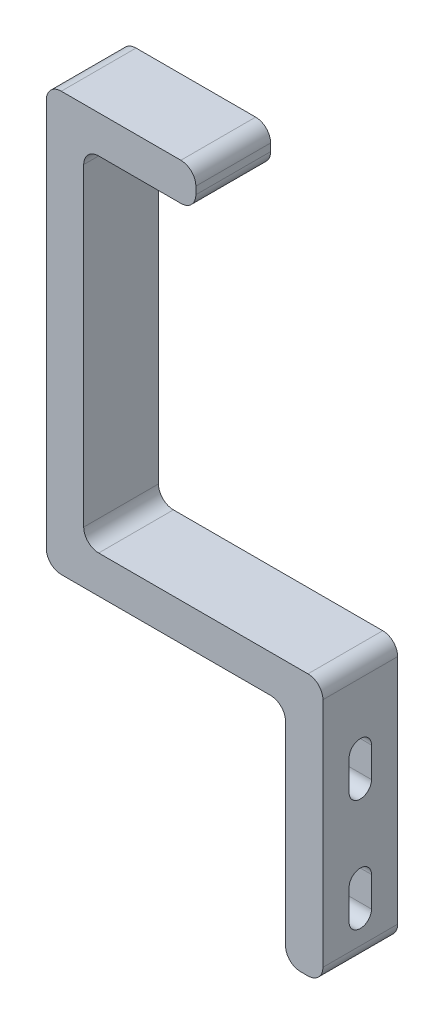
from build123d import *

# Parameters (mm, degrees)
BOSS_EXTRUDE1_DEPTH     = 10
CUT_EXTRUDE1_DEPTH      = 93.303846074
CUT_EXTRUDE1_DEPTH_BACK = 93.303846074
CHAMFER2_SIZE           = 2
CHAMFER2_SIZE2          = 1.154700538
FILLET1_R               = 2


with BuildPart() as part:
    # Sketch1 → Boss-Extrude1 (new body)
    with BuildSketch(Plane.XY):
        Polygon((-14.5, 81), (-29.5, 81), (-29.5, 35), (2.5, 35), (2.5, 0), (-2.5, 0), (-2.5, 30), (-34.5, 30), (-34.5, 86), (-14.5, 86), align=None)
    extrude(amount=BOSS_EXTRUDE1_DEPTH)

    # Sketch3 → Cut-Extrude1 (cut, two sides: drawn at the far end of the back side and taken through both)
    with BuildSketch(Plane.ZY.offset(2.5).offset(-CUT_EXTRUDE1_DEPTH_BACK)):
        with BuildLine():
            Line((6.5, 24.5), (6.5, 20.5))
            ThreePointArc((6.5, 20.5), (5, 19), (3.5, 20.5))
            Line((3.5, 20.5), (3.5, 24.5))
            ThreePointArc((3.5, 24.5), (5, 26), (6.5, 24.5))
        make_face()
        with BuildLine():
            Line((6.5, 5.5), (6.5, 9.5))
            ThreePointArc((6.5, 9.5), (5, 11), (3.5, 9.5))
            Line((3.5, 9.5), (3.5, 5.5))
            ThreePointArc((3.5, 5.5), (5, 4), (6.5, 5.5))
        make_face()
    extrude(amount=CUT_EXTRUDE1_DEPTH + CUT_EXTRUDE1_DEPTH_BACK, mode=Mode.SUBTRACT)

    # Chamfer2
    chamfer2_edges = [part.edges().sort_by_distance(p)[0] for p in [
        (-2.5, 26, 5),
        (-2.5, 22.5, 6.5),
        (-2.5, 19, 5),
        (-2.5, 22.5, 3.5),
        (-2.5, 4, 5),
        (-2.5, 7.5, 3.5),
        (-2.5, 11, 5),
        (-2.5, 7.5, 6.5),
    ]]
    chamfer2_side = [part.faces().sort_by_distance(p)[0] for p in [
        (-2.5, 15, 5),
    ]]
    chamfer(chamfer2_edges, length=CHAMFER2_SIZE, length2=CHAMFER2_SIZE2, reference=chamfer2_side[0])

    # Fillet1
    fillet1_edges = [part.edges().sort_by_distance(p)[0] for p in [
        (-29.5, 81, 5),
        (-29.5, 35, 5),
        (2.5, 35, 5),
        (2.5, 0, 5),
        (-2.5, 0, 5),
        (-2.5, 30, 5),
        (-34.5, 30, 5),
        (-34.5, 86, 5),
        (-14.5, 86, 5),
        (-14.5, 81, 5),
    ]]
    fillet(fillet1_edges, radius=FILLET1_R - 0.0001)  # a hair under: the kernel refuses the full size


solid = part.part
